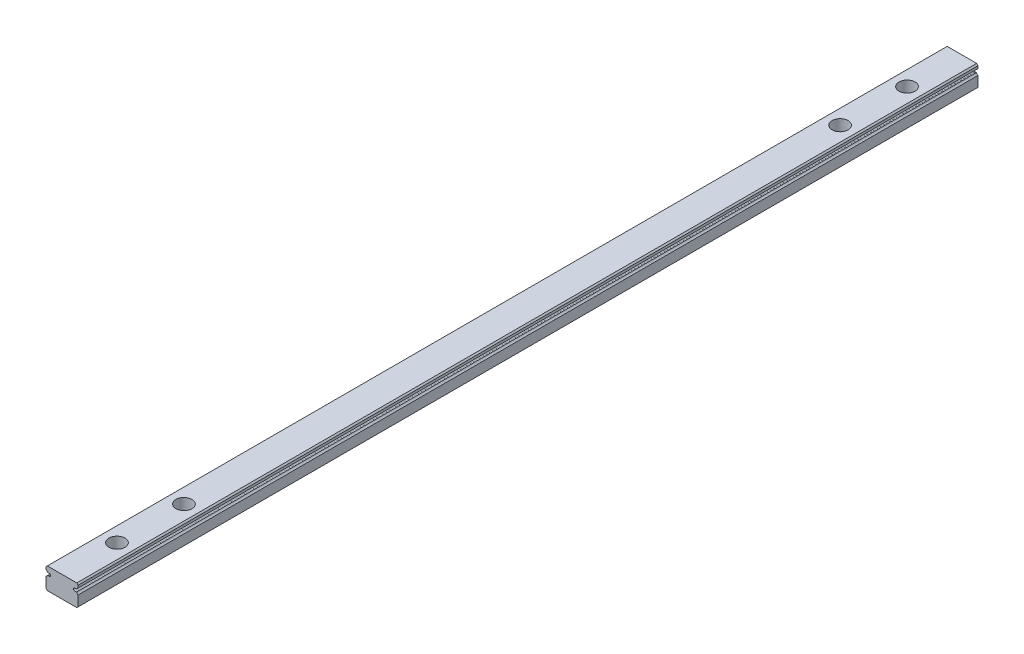
from build123d import *

# Parameters (mm, degrees)
BOSS_EXTRUDE1_DEPTH     = 420
SKETCH2_R               = 3
CUT_EXTRUDE1_DEPTH      = 4.5
SKETCH3_R               = 1.75
CUT_EXTRUDE2_DEPTH      = 421.066958948
LPATTERN1_COUNT         = 4
LPATTERN1_PITCH         = 25
MIRROR1_COPY_1_SKETCH_R = 3
MIRROR1_COPY_1_DEPTH    = 4.5
MIRROR1_COPY_2_SKETCH_R = 3
MIRROR1_COPY_2_DEPTH    = 4.5
MIRROR1_COPY_3_SKETCH_R = 3
MIRROR1_COPY_3_DEPTH    = 4.5
MIRROR1_COPY_4_SKETCH_R = 1.75
MIRROR1_COPY_4_DEPTH    = 421.066958948
MIRROR1_COPY_5_SKETCH_R = 1.75
MIRROR1_COPY_5_DEPTH    = 421.066958948
MIRROR1_COPY_6_SKETCH_R = 1.75
MIRROR1_COPY_6_DEPTH    = 421.066958948
SKETCH5_W               = 12
SKETCH5_H               = 42
CUT_EXTRUDE3_DEPTH      = 421.119030752


with BuildPart() as part:
    # Sketch1 → Boss-Extrude1 (new body)
    with BuildSketch(Plane.XY):
        with BuildLine():
            Line((-5.5, -4), (5.5, -4))
            Line((5.5, -4), (6, -3.5))
            Line((6, -3.5), (6, 0.368911094))
            ThreePointArc((6, 0.368911094), (5.63354293, 0.61854293), (5.383911094, 0.985))
            Line((5.383911094, 0.985), (4.92112495, 0.985))
            ThreePointArc((4.92112495, 0.985), (4.265, 1.46), (4.92112495, 1.935))
            Line((4.92112495, 1.935), (5.383911094, 1.935))
            ThreePointArc((5.383911094, 1.935), (5.63354293, 2.30145707), (6, 2.551088906))
            Line((6, 2.551088906), (6, 3.5))
            Line((6, 3.5), (5.5, 4))
            Line((5.5, 4), (-5.5, 4))
            Line((-5.5, 4), (-6, 3.5))
            Line((-6, 3.5), (-6, 2.551088906))
            ThreePointArc((-6, 2.551088906), (-5.63354293, 2.30145707), (-5.383911094, 1.935))
            Line((-5.383911094, 1.935), (-4.92112495, 1.935))
            ThreePointArc((-4.92112495, 1.935), (-4.265, 1.46), (-4.92112495, 0.985))
            Line((-4.92112495, 0.985), (-5.383911094, 0.985))
            ThreePointArc((-5.383911094, 0.985), (-5.63354293, 0.61854293), (-6, 0.368911094))
            Line((-6, 0.368911094), (-6, -3.5))
            Line((-6, -3.5), (-5.5, -4))
        make_face()
    extrude(amount=BOSS_EXTRUDE1_DEPTH)

    # Sketch2 → Cut-Extrude1 (cut)
    with BuildSketch(Plane(origin=(0, 4, 0), x_dir=(1, 0, 0), z_dir=(0, 1, 0))):
        with Locations((0, -12.5)):
            Circle(SKETCH2_R)
    cut_extrude1 = extrude(amount=-CUT_EXTRUDE1_DEPTH, mode=Mode.SUBTRACT)

    # Sketch3 → Cut-Extrude2 (cut, through all)
    with BuildSketch(Plane(origin=(0, -0.5, 0), x_dir=(1, 0, 0), z_dir=(0, 1, 0))):
        with Locations((0, -12.5)):
            Circle(SKETCH3_R)
    cut_extrude2 = extrude(amount=-CUT_EXTRUDE2_DEPTH, mode=Mode.SUBTRACT)

    # LPattern1: Cut-Extrude1, Cut-Extrude2 ×4
    with Locations(*[(0, 0, i * LPATTERN1_PITCH) for i in range(1, LPATTERN1_COUNT)]):
        add(cut_extrude1, mode=Mode.SUBTRACT)
        add(cut_extrude2, mode=Mode.SUBTRACT)

    # Mirror1: Cut-Extrude1, Cut-Extrude2 across plane
    add(cut_extrude1.mirror(Plane.XY.offset(210)), mode=Mode.SUBTRACT)
    add(cut_extrude2.mirror(Plane.XY.offset(210)), mode=Mode.SUBTRACT)

    # Mirror1 copy 1 sketch → Mirror1 copy 1 (cut)
    with BuildSketch(Plane(origin=(0, 4, 395), x_dir=(1, 0, 0), z_dir=(0, 1, 0))):
        with Locations((0, 12.5)):
            Circle(MIRROR1_COPY_1_SKETCH_R)
    extrude(amount=-MIRROR1_COPY_1_DEPTH, mode=Mode.SUBTRACT)

    # Mirror1 copy 2 sketch → Mirror1 copy 2 (cut)
    with BuildSketch(Plane(origin=(0, 4, 370), x_dir=(1, 0, 0), z_dir=(0, 1, 0))):
        with Locations((0, 12.5)):
            Circle(MIRROR1_COPY_2_SKETCH_R)
    extrude(amount=-MIRROR1_COPY_2_DEPTH, mode=Mode.SUBTRACT)

    # Mirror1 copy 3 sketch → Mirror1 copy 3 (cut)
    with BuildSketch(Plane(origin=(0, 4, 345), x_dir=(1, 0, 0), z_dir=(0, 1, 0))):
        with Locations((0, 12.5)):
            Circle(MIRROR1_COPY_3_SKETCH_R)
    extrude(amount=-MIRROR1_COPY_3_DEPTH, mode=Mode.SUBTRACT)

    # Mirror1 copy 4 sketch → Mirror1 copy 4 (cut, through all)
    with BuildSketch(Plane(origin=(0, -0.5, 395), x_dir=(1, 0, 0), z_dir=(0, 1, 0))):
        with Locations((0, 12.5)):
            Circle(MIRROR1_COPY_4_SKETCH_R)
    extrude(amount=-MIRROR1_COPY_4_DEPTH, mode=Mode.SUBTRACT)

    # Mirror1 copy 5 sketch → Mirror1 copy 5 (cut, through all)
    with BuildSketch(Plane(origin=(0, -0.5, 370), x_dir=(1, 0, 0), z_dir=(0, 1, 0))):
        with Locations((0, 12.5)):
            Circle(MIRROR1_COPY_5_SKETCH_R)
    extrude(amount=-MIRROR1_COPY_5_DEPTH, mode=Mode.SUBTRACT)

    # Mirror1 copy 6 sketch → Mirror1 copy 6 (cut, through all)
    with BuildSketch(Plane(origin=(0, -0.5, 345), x_dir=(1, 0, 0), z_dir=(0, 1, 0))):
        with Locations((0, 12.5)):
            Circle(MIRROR1_COPY_6_SKETCH_R)
    extrude(amount=-MIRROR1_COPY_6_DEPTH, mode=Mode.SUBTRACT)

    # Sketch5 → Cut-Extrude3 (cut, through all)
    with BuildSketch(Plane(origin=(0, 4, 0), x_dir=(1, 0, 0), z_dir=(0, 1, 0))):
        with Locations((0, -399)):
            Rectangle(SKETCH5_W, SKETCH5_H)
    cut_extrude3 = extrude(amount=-CUT_EXTRUDE3_DEPTH, mode=Mode.SUBTRACT)

    # Mirror2: Cut-Extrude3 across plane
    add(cut_extrude3.mirror(Plane.XY.offset(210)), mode=Mode.SUBTRACT)


solid = part.part
